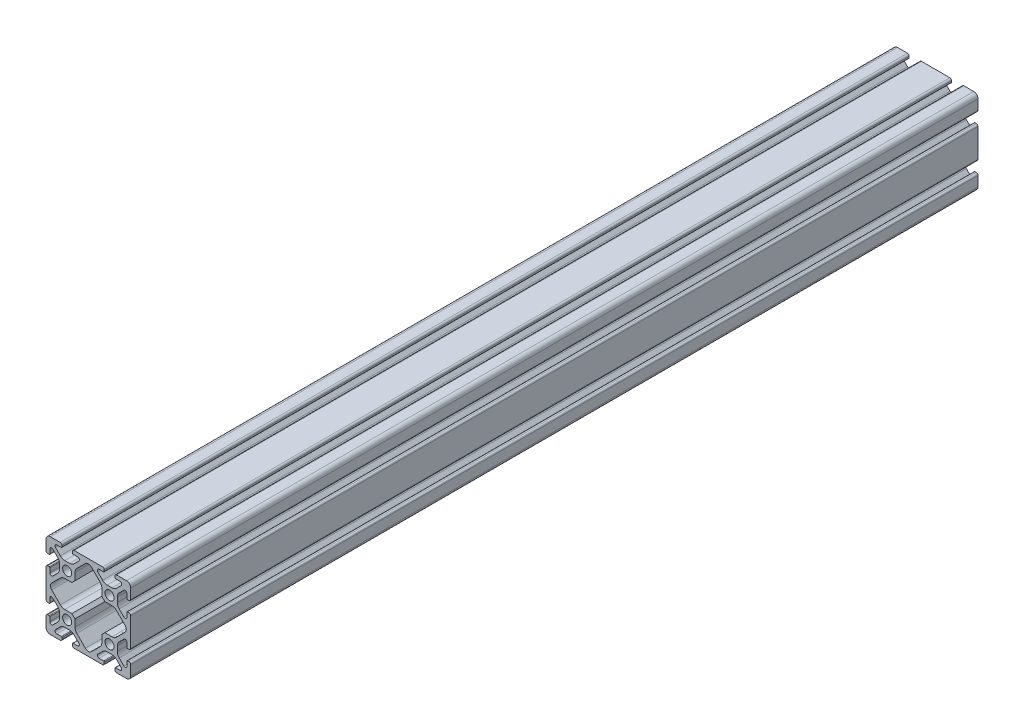
from build123d import *
from OCP.BRepAlgoAPI import BRepAlgoAPI_Cut
from OCP.TopTools import TopTools_ListOfShape

# Parameters (mm, degrees)
SKETCH4_W             = 40
SKETCH4_H             = 40
BODY_DEPTH            = 400
CUT_PROFILE_START     = -200
CUT_PROFILE_OUTLINE_R = 2.15
CUT_PROFILE_DEPTH     = 400


with BuildPart() as part:
    # Sketch4 → Body (new body)
    with BuildSketch(Plane.XY.offset(200)):
        Rectangle(SKETCH4_W, SKETCH4_H)
    extrude(amount=-BODY_DEPTH)


with BuildPart() as cut_profile_tool:
    # Cut-Profile: read off the stored shape, not the designer's step
    # Cut-Profile outline → Cut-Profile (new body)
    with BuildSketch(Plane.XY.offset(CUT_PROFILE_START)):
        with Locations((-9.999999557, 10.000000441)):
            Circle(CUT_PROFILE_OUTLINE_R)
        with Locations((-9.999999557, -9.999999559)):
            Circle(CUT_PROFILE_OUTLINE_R)
        with Locations((10.000000443, -9.999999559)):
            Circle(CUT_PROFILE_OUTLINE_R)
        with Locations((10.000000443, 10.000000441)):
            Circle(CUT_PROFILE_OUTLINE_R)
        with BuildLine():
            Line((13.255887559, -5.471319561), (17.312994561, -1.414212559))
            ThreePointArc((17.312994561, -1.414212559), (17.898780997, 1.124e-06), (17.312994386, 1.414214735))
            Line((17.312994386, 1.414214735), (13.255887299, 5.471320823))
            ThreePointArc((13.255887299, 5.471320823), (12.282617345, 6.121638885), (11.13456722, 6.350000216))
            Line((11.13456722, 6.350000216), (7.79213522, 6.350000216))
            Line((7.79213522, 6.350000216), (6.35000022, 7.792136216))
            Line((6.35000022, 7.792136216), (6.35000022, 11.134567216))
            ThreePointArc((6.35000022, 11.134567216), (6.121638747, 12.282617685), (5.471320301, 13.255887822))
            Line((5.471320301, 13.255887822), (1.414213387, 17.312993733))
            ThreePointArc((1.414213387, 17.312993733), (1e-09, 17.898779994), (-1.414213384, 17.312993732))
            Line((-1.414213384, 17.312993732), (-5.471320297, 13.255887819))
            ThreePointArc((-5.471320297, 13.255887819), (-6.12163874, 12.282617683), (-6.350000213, 11.134567217))
            Line((-6.350000213, 11.134567217), (-6.350000213, 7.792136217))
            Line((-6.350000213, 7.792136217), (-7.792136213, 6.350000217))
            Line((-7.792136213, 6.350000217), (-11.134567213, 6.350000217))
            ThreePointArc((-11.134567213, 6.350000217), (-12.28261751, 6.121638815), (-13.255887557, 5.471320561))
            Line((-13.255887557, 5.471320561), (-17.312993557, 1.414214561))
            ThreePointArc((-17.312993557, 1.414214561), (-17.898779994, 1.124e-06), (-17.312993731, -1.414212385))
            Line((-17.312993731, -1.414212385), (-13.255887818, -5.471319298))
            ThreePointArc((-13.255887818, -5.471319298), (-12.282617682, -6.121637741), (-11.134567216, -6.349999214))
            Line((-11.134567216, -6.349999214), (-7.792136216, -6.349999214))
            Line((-7.792136216, -6.349999214), (-6.350000216, -7.792135214))
            Line((-6.350000216, -7.792135214), (-6.350000216, -11.134566214))
            ThreePointArc((-6.350000216, -11.134566214), (-6.121638814, -12.282616511), (-5.47132056, -13.255886558))
            Line((-5.47132056, -13.255886558), (-1.41421356, -17.312993558))
            ThreePointArc((-1.41421356, -17.312993558), (0, -17.898779994), (1.41421356, -17.312993558))
            Line((1.41421356, -17.312993558), (5.47132056, -13.255886558))
            ThreePointArc((5.47132056, -13.255886558), (6.121638813, -12.282616513), (6.350000215, -11.134566217))
            Line((6.350000215, -11.134566217), (6.350000215, -7.792135217))
            Line((6.350000215, -7.792135217), (7.792135215, -6.349999217))
            Line((7.792135215, -6.349999217), (11.134567215, -6.349999217))
            ThreePointArc((11.134567215, -6.349999217), (12.282617512, -6.121637815), (13.255887559, -5.471319561))
        make_face()
        with BuildLine():
            Line((-18.199999561, 7.20000043), (-18.199999561, 5.08241203))
            ThreePointArc((-18.199999561, 5.08241203), (-17.686138087, 4.313363987), (-16.778984067, 4.49380814))
            Line((-16.778984067, 4.49380814), (-14.528679227, 6.74411298))
            ThreePointArc((-14.528679227, 6.74411298), (-13.878360973, 7.717383026), (-13.649999571, 8.865433323))
            Line((-13.649999571, 8.865433323), (-13.649999571, 11.134567533))
            ThreePointArc((-13.649999571, 11.134567533), (-13.878360973, 12.282617828), (-14.528679226, 13.255887873))
            Line((-14.528679226, 13.255887873), (-16.778984066, 15.506192713))
            ThreePointArc((-16.778984066, 15.506192713), (-17.686138092, 15.686636868), (-18.19999957, 14.917588819))
            Line((-18.19999957, 14.917588819), (-18.19999957, 12.800000419))
            ThreePointArc((-18.19999957, 12.800000419), (-18.287867536, 12.587868385), (-18.49999957, 12.500000419))
            Line((-18.49999957, 12.500000419), (-19.19999957, 12.500000419))
            ThreePointArc((-19.19999957, 12.500000419), (-19.765684995, 12.734314994), (-19.99999957, 13.300000419))
            Line((-19.99999957, 13.300000419), (-19.999999563, 6.70000043))
            ThreePointArc((-19.999999563, 6.70000043), (-19.765684988, 7.265685856), (-19.199999562, 7.500000431))
            Line((-19.199999562, 7.500000431), (-18.499999562, 7.500000431))
            ThreePointArc((-18.499999562, 7.500000431), (-18.287867527, 7.412132465), (-18.199999561, 7.20000043))
        make_face()
        with BuildLine():
            ThreePointArc((-19.199999563, -7.49999957), (-19.765684988, -7.265684995), (-19.999999563, -6.69999957))
            Line((-19.999999563, -6.69999957), (-19.999999557, -13.299999559))
            ThreePointArc((-19.999999557, -13.299999559), (-19.765684982, -12.734314133), (-19.199999556, -12.499999558))
            Line((-19.199999556, -12.499999558), (-18.499999556, -12.499999558))
            ThreePointArc((-18.499999556, -12.499999558), (-18.287867521, -12.587867524), (-18.199999555, -12.799999559))
            Line((-18.199999555, -12.799999559), (-18.199999555, -14.917587959))
            ThreePointArc((-18.199999555, -14.917587959), (-17.68613808, -15.686636002), (-16.778984061, -15.506191849))
            Line((-16.778984061, -15.506191849), (-14.528679221, -13.255887009))
            ThreePointArc((-14.528679221, -13.255887009), (-13.878360967, -12.282616963), (-13.649999564, -11.134566666))
            Line((-13.649999564, -11.134566666), (-13.649999564, -8.865432456))
            ThreePointArc((-13.649999564, -8.865432456), (-13.878360966, -7.717382161), (-14.528679219, -6.744112116))
            Line((-14.528679219, -6.744112116), (-16.778984059, -4.493807276))
            ThreePointArc((-16.778984059, -4.493807276), (-17.686138085, -4.313363121), (-18.199999563, -5.08241117))
            Line((-18.199999563, -5.08241117), (-18.199999563, -7.19999957))
            ThreePointArc((-18.199999563, -7.19999957), (-18.287867529, -7.412131604), (-18.499999563, -7.49999957))
            Line((-18.499999563, -7.49999957), (-19.199999563, -7.49999957))
        make_face()
        with BuildLine():
            Line((-20, 20), (-19.99999957, 18.000000419))
            ThreePointArc((-19.99999957, 18.000000419), (-19.414213132, 19.414213981), (-17.99999957, 20.000000419))
            Line((-17.99999957, 20.000000419), (-20, 20))
        make_face()
        with BuildLine():
            ThreePointArc((-17.999999557, -19.999999559), (-19.414213119, -19.414213121), (-19.999999557, -17.999999559))
            Line((-19.999999557, -17.999999559), (-20, -20))
            Line((-20, -20), (-17.999999557, -19.999999559))
        make_face()
        with BuildLine():
            Line((-6.699999581, 20.000000426), (-13.29999957, 20.000000419))
            ThreePointArc((-13.29999957, 20.000000419), (-12.734314144, 19.765685844), (-12.499999569, 19.200000418))
            Line((-12.499999569, 19.200000418), (-12.499999569, 18.500000418))
            ThreePointArc((-12.499999569, 18.500000418), (-12.587867535, 18.287868383), (-12.79999957, 18.200000417))
            Line((-12.79999957, 18.200000417), (-14.91758797, 18.200000417))
            ThreePointArc((-14.91758797, 18.200000417), (-15.686636013, 17.686138943), (-15.50619186, 16.778984923))
            Line((-15.50619186, 16.778984923), (-13.25588702, 14.528680083))
            ThreePointArc((-13.25588702, 14.528680083), (-12.282616974, 13.878361829), (-11.134566677, 13.650000427))
            Line((-11.134566677, 13.650000427), (-8.865432467, 13.650000427))
            ThreePointArc((-8.865432467, 13.650000427), (-7.717382172, 13.878361829), (-6.744112127, 14.528680082))
            Line((-6.744112127, 14.528680082), (-4.493807287, 16.778984922))
            ThreePointArc((-4.493807287, 16.778984922), (-4.313363132, 17.686138948), (-5.082411181, 18.200000426))
            Line((-5.082411181, 18.200000426), (-7.199999581, 18.200000426))
            ThreePointArc((-7.199999581, 18.200000426), (-7.412131615, 18.287868392), (-7.499999581, 18.500000426))
            Line((-7.499999581, 18.500000426), (-7.499999581, 19.200000426))
            ThreePointArc((-7.499999581, 19.200000426), (-7.265685006, 19.765685851), (-6.699999581, 20.000000426))
        make_face()
        with BuildLine():
            ThreePointArc((-12.499999557, -19.199999559), (-12.734314132, -19.765684984), (-13.299999557, -19.999999559))
            Line((-13.299999557, -19.999999559), (-6.699999568, -19.999999553))
            ThreePointArc((-6.699999568, -19.999999553), (-7.265684994, -19.765684977), (-7.499999569, -19.199999551))
            Line((-7.499999569, -19.199999551), (-7.499999569, -18.499999551))
            ThreePointArc((-7.499999569, -18.499999551), (-7.412131603, -18.287867516), (-7.199999568, -18.19999955))
            Line((-7.199999568, -18.19999955), (-5.082411168, -18.19999955))
            ThreePointArc((-5.082411168, -18.19999955), (-4.313363124, -17.686138076), (-4.493807278, -16.778984056))
            Line((-4.493807278, -16.778984056), (-6.744112118, -14.528679216))
            ThreePointArc((-6.744112118, -14.528679216), (-7.717382164, -13.878360962), (-8.865432461, -13.64999956))
            Line((-8.865432461, -13.64999956), (-11.134566671, -13.64999956))
            ThreePointArc((-11.134566671, -13.64999956), (-12.282616966, -13.878360962), (-13.255887011, -14.528679215))
            Line((-13.255887011, -14.528679215), (-15.506191851, -16.778984055))
            ThreePointArc((-15.506191851, -16.778984055), (-15.686636006, -17.686138081), (-14.917587957, -18.199999559))
            Line((-14.917587957, -18.199999559), (-12.799999557, -18.199999559))
            ThreePointArc((-12.799999557, -18.199999559), (-12.587867523, -18.287867525), (-12.499999557, -18.499999559))
            Line((-12.499999557, -18.499999559), (-12.499999557, -19.199999559))
        make_face()
        with BuildLine():
            Line((13.300000408, 20.000000432), (6.700000419, 20.000000426))
            ThreePointArc((6.700000419, 20.000000426), (7.265685845, 19.76568585), (7.50000042, 19.200000424))
            Line((7.50000042, 19.200000424), (7.50000042, 18.500000424))
            ThreePointArc((7.50000042, 18.500000424), (7.412132454, 18.287868389), (7.200000419, 18.200000423))
            Line((7.200000419, 18.200000423), (5.082412019, 18.200000423))
            ThreePointArc((5.082412019, 18.200000423), (4.313363976, 17.686138949), (4.493808129, 16.778984929))
            Line((4.493808129, 16.778984929), (6.744112969, 14.528680089))
            ThreePointArc((6.744112969, 14.528680089), (7.717383016, 13.878361836), (8.865433312, 13.650000433))
            Line((8.865433312, 13.650000433), (11.134567522, 13.650000433))
            ThreePointArc((11.134567522, 13.650000433), (12.282617817, 13.878361835), (13.255887862, 14.528680088))
            Line((13.255887862, 14.528680088), (15.506192702, 16.778984928))
            ThreePointArc((15.506192702, 16.778984928), (15.686636857, 17.686138954), (14.917588808, 18.200000432))
            Line((14.917588808, 18.200000432), (12.800000408, 18.200000432))
            ThreePointArc((12.800000408, 18.200000432), (12.587868374, 18.287868398), (12.500000408, 18.500000432))
            Line((12.500000408, 18.500000432), (12.500000408, 19.200000432))
            ThreePointArc((12.500000408, 19.200000432), (12.734314983, 19.765685857), (13.300000408, 20.000000432))
        make_face()
        with BuildLine():
            ThreePointArc((7.500000432, -19.199999553), (7.265685856, -19.765684978), (6.700000432, -19.999999553))
            Line((6.700000432, -19.999999553), (13.300000421, -19.999999546))
            ThreePointArc((13.300000421, -19.999999546), (12.734314995, -19.765684971), (12.50000042, -19.199999545))
            Line((12.50000042, -19.199999545), (12.50000042, -18.499999545))
            ThreePointArc((12.50000042, -18.499999545), (12.587868386, -18.28786751), (12.800000421, -18.199999544))
            Line((12.800000421, -18.199999544), (14.917588821, -18.199999544))
            ThreePointArc((14.917588821, -18.199999544), (15.686636865, -17.68613807), (15.506192711, -16.77898405))
            Line((15.506192711, -16.77898405), (13.255887871, -14.52867921))
            ThreePointArc((13.255887871, -14.52867921), (12.282617825, -13.878360956), (11.134567528, -13.649999553))
            Line((11.134567528, -13.649999553), (8.865433318, -13.649999553))
            ThreePointArc((8.865433318, -13.649999553), (7.717383023, -13.878360955), (6.744112978, -14.528679208))
            Line((6.744112978, -14.528679208), (4.493808138, -16.778984048))
            ThreePointArc((4.493808138, -16.778984048), (4.313363983, -17.686138075), (5.082412032, -18.199999553))
            Line((5.082412032, -18.199999553), (7.200000432, -18.199999553))
            ThreePointArc((7.200000432, -18.199999553), (7.412132467, -18.287867518), (7.500000432, -18.499999553))
            Line((7.500000432, -18.499999553), (7.500000432, -19.199999553))
        make_face()
        with BuildLine():
            Line((20, 20), (18.000000408, 20.000000432))
            ThreePointArc((18.000000408, 20.000000432), (19.414213971, 19.414213995), (20.000000408, 18.000000432))
            Line((20.000000408, 18.000000432), (20, 20))
        make_face()
        with BuildLine():
            ThreePointArc((20.000000421, -17.999999546), (19.414213983, -19.414213109), (18.000000421, -19.999999546))
            Line((18.000000421, -19.999999546), (20, -20))
            Line((20, -20), (20.000000421, -17.999999546))
        make_face()
        with BuildLine():
            Line((20.000000415, 6.700000443), (20.000000408, 13.300000432))
            ThreePointArc((20.000000408, 13.300000432), (19.765685833, 12.734315006), (19.200000407, 12.500000431))
            Line((19.200000407, 12.500000431), (18.500000407, 12.500000431))
            ThreePointArc((18.500000407, 12.500000431), (18.287868372, 12.587868397), (18.200000406, 12.800000432))
            Line((18.200000406, 12.800000432), (18.200000406, 14.917588832))
            ThreePointArc((18.200000406, 14.917588832), (17.686138932, 15.686636876), (16.778984912, 15.506192722))
            Line((16.778984912, 15.506192722), (14.528680072, 13.255887882))
            ThreePointArc((14.528680072, 13.255887882), (13.878361818, 12.282617836), (13.650000416, 11.134567539))
            Line((13.650000416, 11.134567539), (13.650000416, 8.865433329))
            ThreePointArc((13.650000416, 8.865433329), (13.878361818, 7.717383034), (14.528680071, 6.744112989))
            Line((14.528680071, 6.744112989), (16.778984911, 4.493808149))
            ThreePointArc((16.778984911, 4.493808149), (17.686138937, 4.313363994), (18.200000415, 5.082412043))
            Line((18.200000415, 5.082412043), (18.200000415, 7.200000443))
            ThreePointArc((18.200000415, 7.200000443), (18.287868381, 7.412132478), (18.500000415, 7.500000443))
            Line((18.500000415, 7.500000443), (19.200000415, 7.500000443))
            ThreePointArc((19.200000415, 7.500000443), (19.76568584, 7.265685868), (20.000000415, 6.700000443))
        make_face()
        with BuildLine():
            ThreePointArc((19.200000421, -12.499999546), (19.765685846, -12.734314121), (20.000000421, -13.299999546))
            Line((20.000000421, -13.299999546), (20.000000415, -6.699999557))
            ThreePointArc((20.000000415, -6.699999557), (19.765685839, -7.265684983), (19.200000413, -7.499999558))
            Line((19.200000413, -7.499999558), (18.500000413, -7.499999558))
            ThreePointArc((18.500000413, -7.499999558), (18.287868378, -7.412131592), (18.200000412, -7.199999557))
            Line((18.200000412, -7.199999557), (18.200000412, -5.082411157))
            ThreePointArc((18.200000412, -5.082411157), (17.686138938, -4.313363114), (16.778984918, -4.493807267))
            Line((16.778984918, -4.493807267), (14.528680078, -6.744112107))
            ThreePointArc((14.528680078, -6.744112107), (13.878361825, -7.717382153), (13.650000422, -8.86543245))
            Line((13.650000422, -8.86543245), (13.650000422, -11.13456666))
            ThreePointArc((13.650000422, -11.13456666), (13.878361824, -12.282616955), (14.528680077, -13.255887))
            Line((14.528680077, -13.255887), (16.778984917, -15.50619184))
            ThreePointArc((16.778984917, -15.50619184), (17.686138943, -15.686635995), (18.200000421, -14.917587946))
            Line((18.200000421, -14.917587946), (18.200000421, -12.799999546))
            ThreePointArc((18.200000421, -12.799999546), (18.287868387, -12.587867512), (18.500000421, -12.499999546))
            Line((18.500000421, -12.499999546), (19.200000421, -12.499999546))
        make_face()
    extrude(amount=CUT_PROFILE_DEPTH)


with BuildPart() as part_1:
    add(part.part)

    # Cut-Profile: cut by cut_profile_tool, with a tolerance
    cut_profile_stock = TopTools_ListOfShape()
    cut_profile_stock.Append(part_1.part.wrapped)
    cut_profile_tools = TopTools_ListOfShape()
    cut_profile_tools.Append(cut_profile_tool.part.wrapped)
    cut_profile_cut = BRepAlgoAPI_Cut()
    cut_profile_cut.SetArguments(cut_profile_stock)
    cut_profile_cut.SetTools(cut_profile_tools)
    cut_profile_cut.SetFuzzyValue(0.00001)
    cut_profile_cut.Build()
    add(Compound.cast(cut_profile_cut.Shape()).solids(), mode=Mode.REPLACE)


solid = part_1.part
